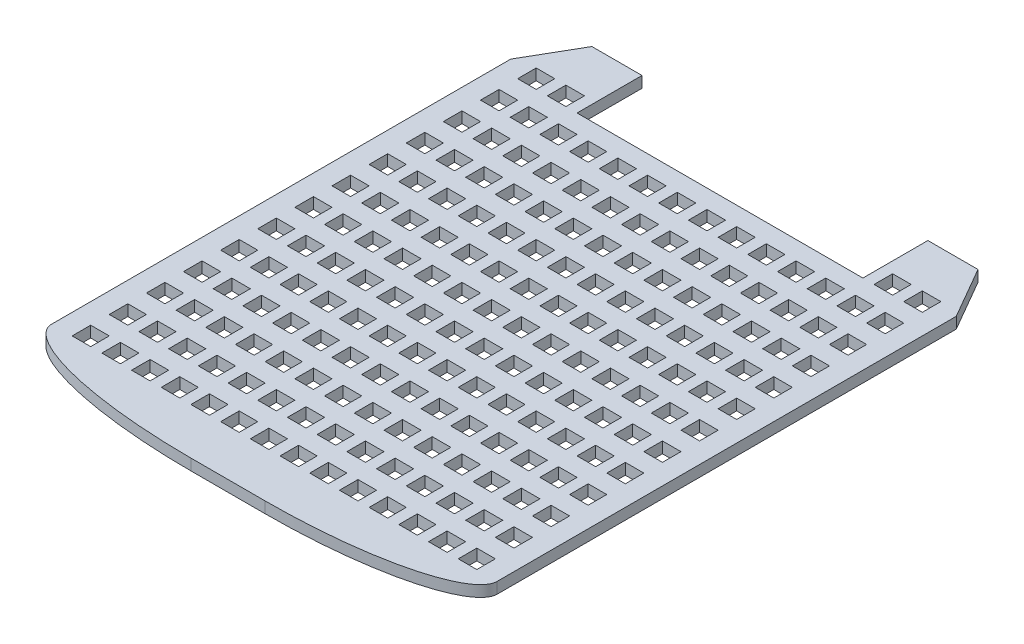
from build123d import *

# Parameters (mm, degrees)
SKETCH1_W           = 120
SKETCH1_H           = 150
BOSS_EXTRUDE1_DEPTH = 3
SKETCH2_W           = 5
SKETCH2_H           = 5
CUT_EXTRUDE1_DEPTH  = 97.093704268
FILLET1_SIZE        = 12.5
FILLET1_SIZE_2      = 50
FILLET2_SIZE        = 12.5
FILLET2_SIZE_2      = 50
CUT_EXTRUDE2_DEPTH  = 97.093704412
SKETCH5_W           = 77
SKETCH5_H           = 17.5
CUT_EXTRUDE3_DEPTH  = 97.093704412


with BuildPart() as part:
    # Sketch1 → Boss-Extrude1 (new body)
    with BuildSketch(Plane(origin=(0, 0, 0), x_dir=(1, 0, 0), z_dir=(0, 1, 0))):
        Rectangle(SKETCH1_W, SKETCH1_H)
    extrude(amount=BOSS_EXTRUDE1_DEPTH)

    # Sketch2 → Cut-Extrude1 (cut, through all)
    with BuildSketch(Plane(origin=(0, 3, 0), x_dir=(1, 0, 0), z_dir=(0, 1, 0))):
        with Locations((-52, 60)):
            Rectangle(SKETCH2_W, SKETCH2_H)
        with Locations((-44, 60)):
            Rectangle(SKETCH2_W, SKETCH2_H)
        with Locations((-36, 60)):
            Rectangle(SKETCH2_W, SKETCH2_H)
        with Locations((-28, 60)):
            Rectangle(SKETCH2_W, SKETCH2_H)
        with Locations((-20, 60)):
            Rectangle(SKETCH2_W, SKETCH2_H)
        with Locations((-12, 60)):
            Rectangle(SKETCH2_W, SKETCH2_H)
        with Locations((-4, 60)):
            Rectangle(SKETCH2_W, SKETCH2_H)
        with Locations((4, 60)):
            Rectangle(SKETCH2_W, SKETCH2_H)
        with Locations((12, 60)):
            Rectangle(SKETCH2_W, SKETCH2_H)
        with Locations((20, 60)):
            Rectangle(SKETCH2_W, SKETCH2_H)
        with Locations((28, 60)):
            Rectangle(SKETCH2_W, SKETCH2_H)
        with Locations((36, 60)):
            Rectangle(SKETCH2_W, SKETCH2_H)
        with Locations((44, 60)):
            Rectangle(SKETCH2_W, SKETCH2_H)
        with Locations((52, 60)):
            Rectangle(SKETCH2_W, SKETCH2_H)
        with Locations((-44, 50)):
            Rectangle(SKETCH2_W, SKETCH2_H)
        with Locations((-36, 50)):
            Rectangle(SKETCH2_W, SKETCH2_H)
        with Locations((-28, 50)):
            Rectangle(SKETCH2_W, SKETCH2_H)
        with Locations((-20, 50)):
            Rectangle(SKETCH2_W, SKETCH2_H)
        with Locations((-12, 50)):
            Rectangle(SKETCH2_W, SKETCH2_H)
        with Locations((-4, 50)):
            Rectangle(SKETCH2_W, SKETCH2_H)
        with Locations((4, 50)):
            Rectangle(SKETCH2_W, SKETCH2_H)
        with Locations((12, 50)):
            Rectangle(SKETCH2_W, SKETCH2_H)
        with Locations((20, 50)):
            Rectangle(SKETCH2_W, SKETCH2_H)
        with Locations((28, 50)):
            Rectangle(SKETCH2_W, SKETCH2_H)
        with Locations((36, 50)):
            Rectangle(SKETCH2_W, SKETCH2_H)
        with Locations((44, 50)):
            Rectangle(SKETCH2_W, SKETCH2_H)
        with Locations((52, 50)):
            Rectangle(SKETCH2_W, SKETCH2_H)
        with Locations((-44, 40)):
            Rectangle(SKETCH2_W, SKETCH2_H)
        with Locations((-36, 40)):
            Rectangle(SKETCH2_W, SKETCH2_H)
        with Locations((-28, 40)):
            Rectangle(SKETCH2_W, SKETCH2_H)
        with Locations((-20, 40)):
            Rectangle(SKETCH2_W, SKETCH2_H)
        with Locations((-12, 40)):
            Rectangle(SKETCH2_W, SKETCH2_H)
        with Locations((-4, 40)):
            Rectangle(SKETCH2_W, SKETCH2_H)
        with Locations((4, 40)):
            Rectangle(SKETCH2_W, SKETCH2_H)
        with Locations((12, 40)):
            Rectangle(SKETCH2_W, SKETCH2_H)
        with Locations((20, 40)):
            Rectangle(SKETCH2_W, SKETCH2_H)
        with Locations((28, 40)):
            Rectangle(SKETCH2_W, SKETCH2_H)
        with Locations((36, 40)):
            Rectangle(SKETCH2_W, SKETCH2_H)
        with Locations((44, 40)):
            Rectangle(SKETCH2_W, SKETCH2_H)
        with Locations((52, 40)):
            Rectangle(SKETCH2_W, SKETCH2_H)
        with Locations((-44, 30)):
            Rectangle(SKETCH2_W, SKETCH2_H)
        with Locations((-36, 30)):
            Rectangle(SKETCH2_W, SKETCH2_H)
        with Locations((-28, 30)):
            Rectangle(SKETCH2_W, SKETCH2_H)
        with Locations((-20, 30)):
            Rectangle(SKETCH2_W, SKETCH2_H)
        with Locations((-12, 30)):
            Rectangle(SKETCH2_W, SKETCH2_H)
        with Locations((-4, 30)):
            Rectangle(SKETCH2_W, SKETCH2_H)
        with Locations((4, 30)):
            Rectangle(SKETCH2_W, SKETCH2_H)
        with Locations((12, 30)):
            Rectangle(SKETCH2_W, SKETCH2_H)
        with Locations((20, 30)):
            Rectangle(SKETCH2_W, SKETCH2_H)
        with Locations((28, 30)):
            Rectangle(SKETCH2_W, SKETCH2_H)
        with Locations((36, 30)):
            Rectangle(SKETCH2_W, SKETCH2_H)
        with Locations((44, 30)):
            Rectangle(SKETCH2_W, SKETCH2_H)
        with Locations((52, 30)):
            Rectangle(SKETCH2_W, SKETCH2_H)
        with Locations((-44, 20)):
            Rectangle(SKETCH2_W, SKETCH2_H)
        with Locations((-36, 20)):
            Rectangle(SKETCH2_W, SKETCH2_H)
        with Locations((-28, 20)):
            Rectangle(SKETCH2_W, SKETCH2_H)
        with Locations((-20, 20)):
            Rectangle(SKETCH2_W, SKETCH2_H)
        with Locations((-12, 20)):
            Rectangle(SKETCH2_W, SKETCH2_H)
        with Locations((-4, 20)):
            Rectangle(SKETCH2_W, SKETCH2_H)
        with Locations((4, 20)):
            Rectangle(SKETCH2_W, SKETCH2_H)
        with Locations((12, 20)):
            Rectangle(SKETCH2_W, SKETCH2_H)
        with Locations((20, 20)):
            Rectangle(SKETCH2_W, SKETCH2_H)
        with Locations((28, 20)):
            Rectangle(SKETCH2_W, SKETCH2_H)
        with Locations((36, 20)):
            Rectangle(SKETCH2_W, SKETCH2_H)
        with Locations((44, 20)):
            Rectangle(SKETCH2_W, SKETCH2_H)
        with Locations((52, 20)):
            Rectangle(SKETCH2_W, SKETCH2_H)
        with Locations((-44, 10)):
            Rectangle(SKETCH2_W, SKETCH2_H)
        with Locations((-36, 10)):
            Rectangle(SKETCH2_W, SKETCH2_H)
        with Locations((-28, 10)):
            Rectangle(SKETCH2_W, SKETCH2_H)
        with Locations((-20, 10)):
            Rectangle(SKETCH2_W, SKETCH2_H)
        with Locations((-12, 10)):
            Rectangle(SKETCH2_W, SKETCH2_H)
        with Locations((-4, 10)):
            Rectangle(SKETCH2_W, SKETCH2_H)
        with Locations((4, 10)):
            Rectangle(SKETCH2_W, SKETCH2_H)
        with Locations((12, 10)):
            Rectangle(SKETCH2_W, SKETCH2_H)
        with Locations((20, 10)):
            Rectangle(SKETCH2_W, SKETCH2_H)
        with Locations((28, 10)):
            Rectangle(SKETCH2_W, SKETCH2_H)
        with Locations((36, 10)):
            Rectangle(SKETCH2_W, SKETCH2_H)
        with Locations((44, 10)):
            Rectangle(SKETCH2_W, SKETCH2_H)
        with Locations((52, 10)):
            Rectangle(SKETCH2_W, SKETCH2_H)
        with Locations((-44, 0)):
            Rectangle(SKETCH2_W, SKETCH2_H)
        with Locations((-36, 0)):
            Rectangle(SKETCH2_W, SKETCH2_H)
        with Locations((-28, 0)):
            Rectangle(SKETCH2_W, SKETCH2_H)
        with Locations((-20, 0)):
            Rectangle(SKETCH2_W, SKETCH2_H)
        with Locations((-12, 0)):
            Rectangle(SKETCH2_W, SKETCH2_H)
        with Locations((-4, 0)):
            Rectangle(SKETCH2_W, SKETCH2_H)
        with Locations((4, 0)):
            Rectangle(SKETCH2_W, SKETCH2_H)
        with Locations((12, 0)):
            Rectangle(SKETCH2_W, SKETCH2_H)
        with Locations((20, 0)):
            Rectangle(SKETCH2_W, SKETCH2_H)
        with Locations((28, 0)):
            Rectangle(SKETCH2_W, SKETCH2_H)
        with Locations((36, 0)):
            Rectangle(SKETCH2_W, SKETCH2_H)
        with Locations((44, 0)):
            Rectangle(SKETCH2_W, SKETCH2_H)
        with Locations((52, 0)):
            Rectangle(SKETCH2_W, SKETCH2_H)
        with Locations((-44, -10)):
            Rectangle(SKETCH2_W, SKETCH2_H)
        with Locations((-36, -10)):
            Rectangle(SKETCH2_W, SKETCH2_H)
        with Locations((-28, -10)):
            Rectangle(SKETCH2_W, SKETCH2_H)
        with Locations((-20, -10)):
            Rectangle(SKETCH2_W, SKETCH2_H)
        with Locations((-12, -10)):
            Rectangle(SKETCH2_W, SKETCH2_H)
        with Locations((-4, -10)):
            Rectangle(SKETCH2_W, SKETCH2_H)
        with Locations((4, -10)):
            Rectangle(SKETCH2_W, SKETCH2_H)
        with Locations((12, -10)):
            Rectangle(SKETCH2_W, SKETCH2_H)
        with Locations((20, -10)):
            Rectangle(SKETCH2_W, SKETCH2_H)
        with Locations((28, -10)):
            Rectangle(SKETCH2_W, SKETCH2_H)
        with Locations((36, -10)):
            Rectangle(SKETCH2_W, SKETCH2_H)
        with Locations((44, -10)):
            Rectangle(SKETCH2_W, SKETCH2_H)
        with Locations((52, -10)):
            Rectangle(SKETCH2_W, SKETCH2_H)
        with Locations((-44, -20)):
            Rectangle(SKETCH2_W, SKETCH2_H)
        with Locations((-36, -20)):
            Rectangle(SKETCH2_W, SKETCH2_H)
        with Locations((-28, -20)):
            Rectangle(SKETCH2_W, SKETCH2_H)
        with Locations((-20, -20)):
            Rectangle(SKETCH2_W, SKETCH2_H)
        with Locations((-12, -20)):
            Rectangle(SKETCH2_W, SKETCH2_H)
        with Locations((-4, -20)):
            Rectangle(SKETCH2_W, SKETCH2_H)
        with Locations((4, -20)):
            Rectangle(SKETCH2_W, SKETCH2_H)
        with Locations((12, -20)):
            Rectangle(SKETCH2_W, SKETCH2_H)
        with Locations((20, -20)):
            Rectangle(SKETCH2_W, SKETCH2_H)
        with Locations((28, -20)):
            Rectangle(SKETCH2_W, SKETCH2_H)
        with Locations((36, -20)):
            Rectangle(SKETCH2_W, SKETCH2_H)
        with Locations((44, -20)):
            Rectangle(SKETCH2_W, SKETCH2_H)
        with Locations((52, -20)):
            Rectangle(SKETCH2_W, SKETCH2_H)
        with Locations((-44, -30)):
            Rectangle(SKETCH2_W, SKETCH2_H)
        with Locations((-36, -30)):
            Rectangle(SKETCH2_W, SKETCH2_H)
        with Locations((-28, -30)):
            Rectangle(SKETCH2_W, SKETCH2_H)
        with Locations((-20, -30)):
            Rectangle(SKETCH2_W, SKETCH2_H)
        with Locations((-12, -30)):
            Rectangle(SKETCH2_W, SKETCH2_H)
        with Locations((-4, -30)):
            Rectangle(SKETCH2_W, SKETCH2_H)
        with Locations((4, -30)):
            Rectangle(SKETCH2_W, SKETCH2_H)
        with Locations((12, -30)):
            Rectangle(SKETCH2_W, SKETCH2_H)
        with Locations((20, -30)):
            Rectangle(SKETCH2_W, SKETCH2_H)
        with Locations((28, -30)):
            Rectangle(SKETCH2_W, SKETCH2_H)
        with Locations((36, -30)):
            Rectangle(SKETCH2_W, SKETCH2_H)
        with Locations((44, -30)):
            Rectangle(SKETCH2_W, SKETCH2_H)
        with Locations((52, -30)):
            Rectangle(SKETCH2_W, SKETCH2_H)
        with Locations((-44, -40)):
            Rectangle(SKETCH2_W, SKETCH2_H)
        with Locations((-36, -40)):
            Rectangle(SKETCH2_W, SKETCH2_H)
        with Locations((-28, -40)):
            Rectangle(SKETCH2_W, SKETCH2_H)
        with Locations((-20, -40)):
            Rectangle(SKETCH2_W, SKETCH2_H)
        with Locations((-12, -40)):
            Rectangle(SKETCH2_W, SKETCH2_H)
        with Locations((-4, -40)):
            Rectangle(SKETCH2_W, SKETCH2_H)
        with Locations((4, -40)):
            Rectangle(SKETCH2_W, SKETCH2_H)
        with Locations((12, -40)):
            Rectangle(SKETCH2_W, SKETCH2_H)
        with Locations((20, -40)):
            Rectangle(SKETCH2_W, SKETCH2_H)
        with Locations((28, -40)):
            Rectangle(SKETCH2_W, SKETCH2_H)
        with Locations((36, -40)):
            Rectangle(SKETCH2_W, SKETCH2_H)
        with Locations((44, -40)):
            Rectangle(SKETCH2_W, SKETCH2_H)
        with Locations((52, -40)):
            Rectangle(SKETCH2_W, SKETCH2_H)
        with Locations((-44, -50)):
            Rectangle(SKETCH2_W, SKETCH2_H)
        with Locations((-36, -50)):
            Rectangle(SKETCH2_W, SKETCH2_H)
        with Locations((-28, -50)):
            Rectangle(SKETCH2_W, SKETCH2_H)
        with Locations((-20, -50)):
            Rectangle(SKETCH2_W, SKETCH2_H)
        with Locations((-12, -50)):
            Rectangle(SKETCH2_W, SKETCH2_H)
        with Locations((-4, -50)):
            Rectangle(SKETCH2_W, SKETCH2_H)
        with Locations((4, -50)):
            Rectangle(SKETCH2_W, SKETCH2_H)
        with Locations((12, -50)):
            Rectangle(SKETCH2_W, SKETCH2_H)
        with Locations((20, -50)):
            Rectangle(SKETCH2_W, SKETCH2_H)
        with Locations((28, -50)):
            Rectangle(SKETCH2_W, SKETCH2_H)
        with Locations((36, -50)):
            Rectangle(SKETCH2_W, SKETCH2_H)
        with Locations((44, -50)):
            Rectangle(SKETCH2_W, SKETCH2_H)
        with Locations((52, -50)):
            Rectangle(SKETCH2_W, SKETCH2_H)
        with Locations((-44, -60)):
            Rectangle(SKETCH2_W, SKETCH2_H)
        with Locations((-36, -60)):
            Rectangle(SKETCH2_W, SKETCH2_H)
        with Locations((-28, -60)):
            Rectangle(SKETCH2_W, SKETCH2_H)
        with Locations((-20, -60)):
            Rectangle(SKETCH2_W, SKETCH2_H)
        with Locations((-12, -60)):
            Rectangle(SKETCH2_W, SKETCH2_H)
        with Locations((-4, -60)):
            Rectangle(SKETCH2_W, SKETCH2_H)
        with Locations((4, -60)):
            Rectangle(SKETCH2_W, SKETCH2_H)
        with Locations((12, -60)):
            Rectangle(SKETCH2_W, SKETCH2_H)
        with Locations((20, -60)):
            Rectangle(SKETCH2_W, SKETCH2_H)
        with Locations((28, -60)):
            Rectangle(SKETCH2_W, SKETCH2_H)
        with Locations((36, -60)):
            Rectangle(SKETCH2_W, SKETCH2_H)
        with Locations((44, -60)):
            Rectangle(SKETCH2_W, SKETCH2_H)
        with Locations((52, -60)):
            Rectangle(SKETCH2_W, SKETCH2_H)
        with Locations((-52, 50)):
            Rectangle(SKETCH2_W, SKETCH2_H)
        with Locations((-52, 40)):
            Rectangle(SKETCH2_W, SKETCH2_H)
        with Locations((-52, 30)):
            Rectangle(SKETCH2_W, SKETCH2_H)
        with Locations((-52, 20)):
            Rectangle(SKETCH2_W, SKETCH2_H)
        with Locations((-52, 10)):
            Rectangle(SKETCH2_W, SKETCH2_H)
        with Locations((-52, 0)):
            Rectangle(SKETCH2_W, SKETCH2_H)
        with Locations((-52, -10)):
            Rectangle(SKETCH2_W, SKETCH2_H)
        with Locations((-52, -20)):
            Rectangle(SKETCH2_W, SKETCH2_H)
        with Locations((-52, -30)):
            Rectangle(SKETCH2_W, SKETCH2_H)
        with Locations((-52, -40)):
            Rectangle(SKETCH2_W, SKETCH2_H)
        with Locations((-52, -50)):
            Rectangle(SKETCH2_W, SKETCH2_H)
        with Locations((-52, -60)):
            Rectangle(SKETCH2_W, SKETCH2_H)
    extrude(amount=-CUT_EXTRUDE1_DEPTH, mode=Mode.SUBTRACT)

    # Fillet1
    # a fillet whose section is not a circle: 50, 12.5 mm, written as the material it takes off along each edge
    with BuildSketch(Plane(origin=(-60, -125, 75), x_dir=(0, 0, -1), z_dir=(0, 1, 0))) as fillet1_piece_1:
        with BuildLine():
            Bezier((FILLET1_SIZE, 0), (0, 0), (0, -FILLET1_SIZE_2), weights=[1, 0.707106781, 1])
            Line((0, -FILLET1_SIZE_2), (0, 0))
            Line((0, 0), (FILLET1_SIZE, 0))
        make_face()
    extrude(amount=253, mode=Mode.SUBTRACT)

    # Fillet2
    # a fillet whose section is not a circle: 50, 12.5 mm, written as the material it takes off along each edge
    with BuildSketch(Plane(origin=(60, -125, 75), x_dir=(0, 0, -1), z_dir=(0, 1, 0))) as fillet2_piece_1:
        with BuildLine():
            Bezier((FILLET2_SIZE, 0), (0, 0), (0, FILLET2_SIZE_2), weights=[1, 0.707106781, 1])
            Line((0, FILLET2_SIZE_2), (0, 0))
            Line((0, 0), (FILLET2_SIZE, 0))
        make_face()
    extrude(amount=253, mode=Mode.SUBTRACT)

    # Sketch4 → Cut-Extrude2 (cut, through all)
    with BuildSketch(Plane(origin=(0, 3, 0), x_dir=(1, 0, 0), z_dir=(0, 1, 0))):
        Polygon((-60, 61.143593539), (-60, 75), (-52, 75), align=None)
        Polygon((60, 75), (52, 75), (60, 61.143593539), align=None)
    extrude(amount=-CUT_EXTRUDE2_DEPTH, mode=Mode.SUBTRACT)

    # Sketch5 → Cut-Extrude3 (cut, through all)
    with BuildSketch(Plane(origin=(0, 3, 0), x_dir=(1, 0, 0), z_dir=(0, 1, 0))):
        with Locations((0, 66.25)):
            Rectangle(SKETCH5_W, SKETCH5_H)
    extrude(amount=-CUT_EXTRUDE3_DEPTH, mode=Mode.SUBTRACT)


solid = part.part
